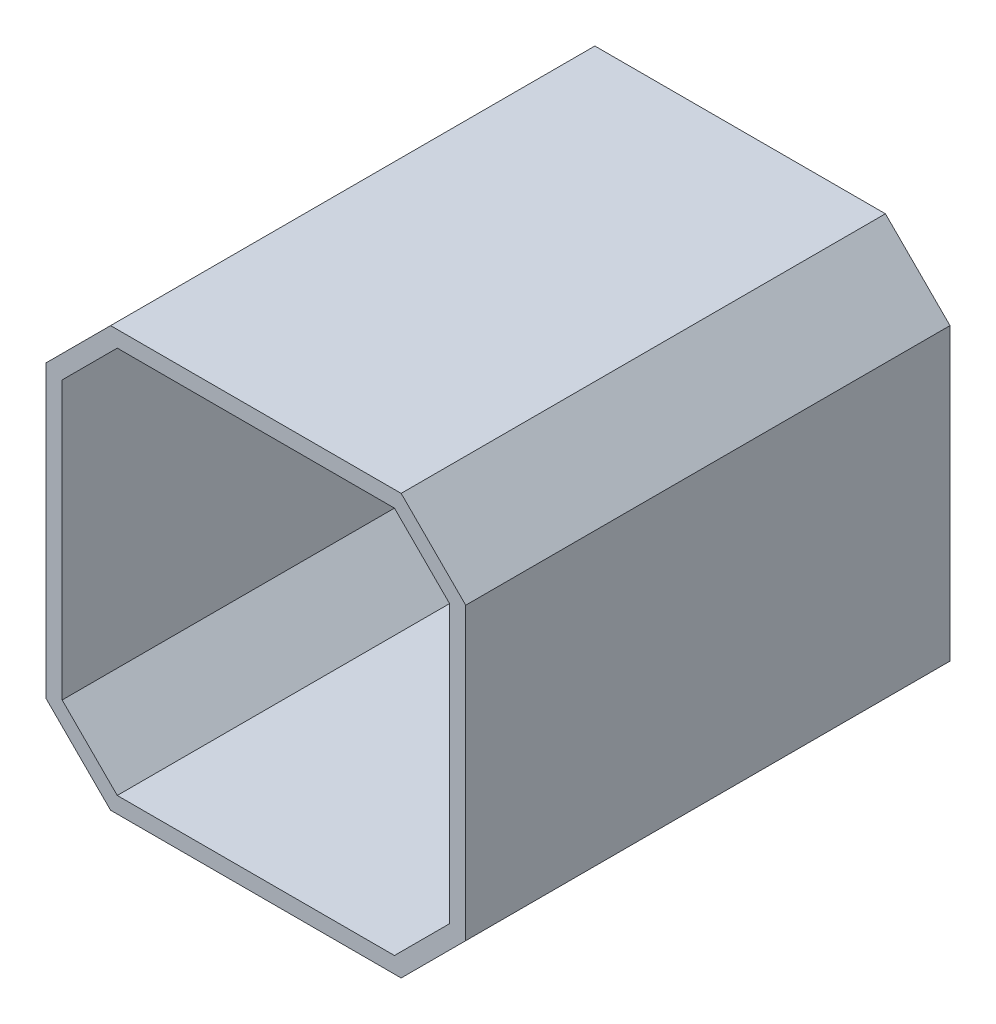
from build123d import *

# Parameters (mm, degrees)
BOSS_EXTRUDE1_DEPTH = 75
SKETCH2_R           = 5
BOSS_EXTRUDE2_DEPTH = 2.5


with BuildPart() as part:
    # Sketch1 → Boss-Extrude1 (new body)
    with BuildSketch(Plane.XY):
        Polygon((-32.5, 22.5), (-22.5, 32.5), (22.5, 32.5), (32.5, 22.5), (32.5, -22.5), (22.5, -32.5), (-22.5, -32.5), (-32.5, -22.5), align=None)
        Polygon((-30, 21.464466094), (-21.464466094, 30), (21.464466094, 30), (30, 21.464466094), (30, -21.464466094), (21.464466094, -30), (-21.464466094, -30), (-30, -21.464466094), align=None, mode=Mode.SUBTRACT)
    extrude(amount=BOSS_EXTRUDE1_DEPTH)

    # Sketch2 → Boss-Extrude2 (add)
    with BuildSketch(Plane.XY):
        Polygon((30, 21.464466094), (21.464466094, 30), (-21.464466094, 30), (-30, 21.464466094), (-30, -21.464466094), (-21.464466094, -30), (21.464466094, -30), (30, -21.464466094), align=None)
        Circle(SKETCH2_R, mode=Mode.SUBTRACT)
    extrude(amount=BOSS_EXTRUDE2_DEPTH)


solid = part.part
